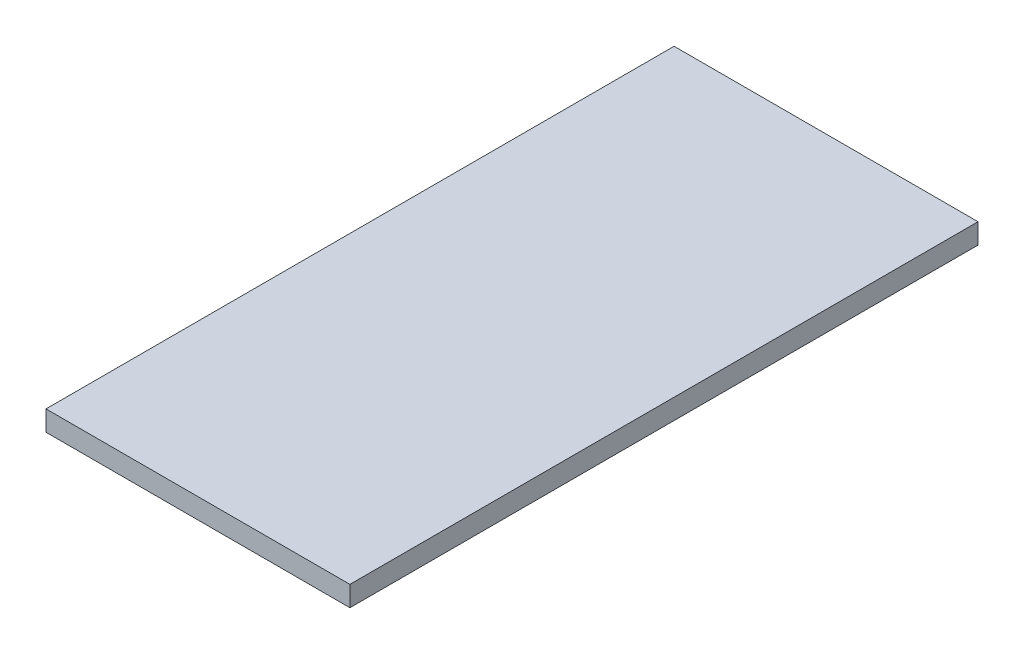
from build123d import *

# Parameters (mm, degrees)
CROQUIS1_W              = 15
CROQUIS1_H              = 31
SALIENTE_EXTRUIR1_DEPTH = 1


with BuildPart() as part:
    # Croquis1 → Saliente-Extruir1 (new body)
    with BuildSketch(Plane(origin=(0, 0, 0), x_dir=(1, 0, 0), z_dir=(0, 1, 0))):
        with Locations((-12.5, 0)):
            Rectangle(CROQUIS1_W, CROQUIS1_H)
    extrude(amount=SALIENTE_EXTRUIR1_DEPTH)


solid = part.part
